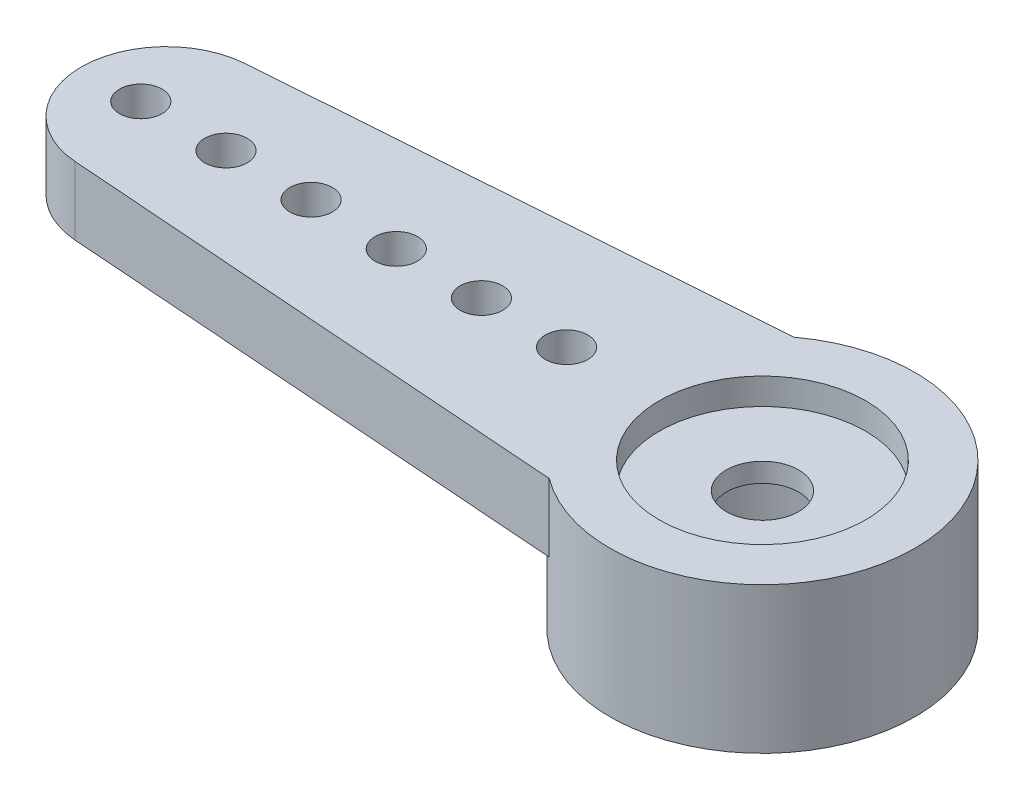
from build123d import *

# Parameters (mm, degrees)
SALIENTE_EXTRUIR1_DEPTH       = 1.6
CROQUIS2_R                    = 3.58
SALIENTE_EXTRUIR2_DEPTH       = 1.83
DI_METRO_DE_TALADRO_1_0_1_1_D = 1
CORTAR_EXTRUIR1_DEPTH         = 25.109029429


with BuildPart() as part:
    # Croquis1 → Saliente-Extruir1 (new body)
    with BuildSketch(Plane(origin=(0, 14.27, 0), x_dir=(1, 0, 0), z_dir=(0, 1, 0))):
        with BuildLine():
            Line((8.033254556, 3.025), (20.046175024, 3.905348937))
            ThreePointArc((20.046175024, 3.905348937), (21.9, 5.9), (20.046175024, 7.894651063))
            Line((20.046175024, 7.894651063), (8.033254556, 8.775))
            ThreePointArc((8.033254556, 8.775), (5.9, 9.48), (3.766745444, 8.775))
            Line((3.766745444, 8.775), (-8.246175024, 7.894651063))
            ThreePointArc((-8.246175024, 7.894651063), (-10.1, 5.9), (-8.246175024, 3.905348937))
            Line((-8.246175024, 3.905348937), (3.766745444, 3.025))
            ThreePointArc((3.766745444, 3.025), (5.9, 2.32), (8.033254556, 3.025))
        make_face()
    extrude(amount=-SALIENTE_EXTRUIR1_DEPTH)

    # Croquis2 → Saliente-Extruir2 (add)
    with BuildSketch(Plane.XZ.offset(-12.67)):
        with Locations((5.9, -5.9)):
            Circle(CROQUIS2_R)
    extrude(amount=SALIENTE_EXTRUIR2_DEPTH)

    # Croquis3 → Cortar-Revolución1 (revolve, cut)
    with BuildSketch(Plane.XY.offset(-5.9)):
        Polygon((8.325, 14.27), (5.9, 14.27), (5.9, 10.84), (8.2, 10.84), (8.2, 13.2), (6.75, 13.2), (6.75, 13.65), (8.325, 13.65), align=None)
    revolve(axis=Axis((5.9, 14.27, -5.9), (0, -1, 0)), mode=Mode.SUBTRACT)

    # Diámetro de taladro Ø1.0 (1)1 (through all)
    with Locations(Plane(origin=(0, 12.67, 0), x_dir=(-1, 0, 0), z_dir=(0, -1, 0))):
        with Locations((2.7, 5.9), (6.7, 5.9), (8.7, 5.9), (4.7, 5.9), (0.7, 5.9), (-10.5, 5.9), (-14.5, 5.9), (-18.5, 5.9), (-20.5, 5.9), (-16.5, 5.9), (-12.5, 5.9), (-1.3, 5.9)):
            Hole(DI_METRO_DE_TALADRO_1_0_1_1_D / 2)

    # Croquis6 → Cortar-Extruir1 (cut, through all)
    with BuildSketch(Plane.XZ.offset(-10.84)):
        with BuildLine():
            Line((5.9, -9.48), (5.9, -13.293160377))
            Line((5.9, -13.293160377), (27.115989236, -13.293160377))
            Line((27.115989236, -13.293160377), (27.115989236, 2.204986014))
            Line((27.115989236, 2.204986014), (5.9, 2.204986014))
            Line((5.9, 2.204986014), (5.9, -2.32))
            ThreePointArc((5.9, -2.32), (9.48, -5.9), (5.9, -9.48))
        make_face()
    extrude(amount=-CORTAR_EXTRUIR1_DEPTH, mode=Mode.SUBTRACT)


solid = part.part
